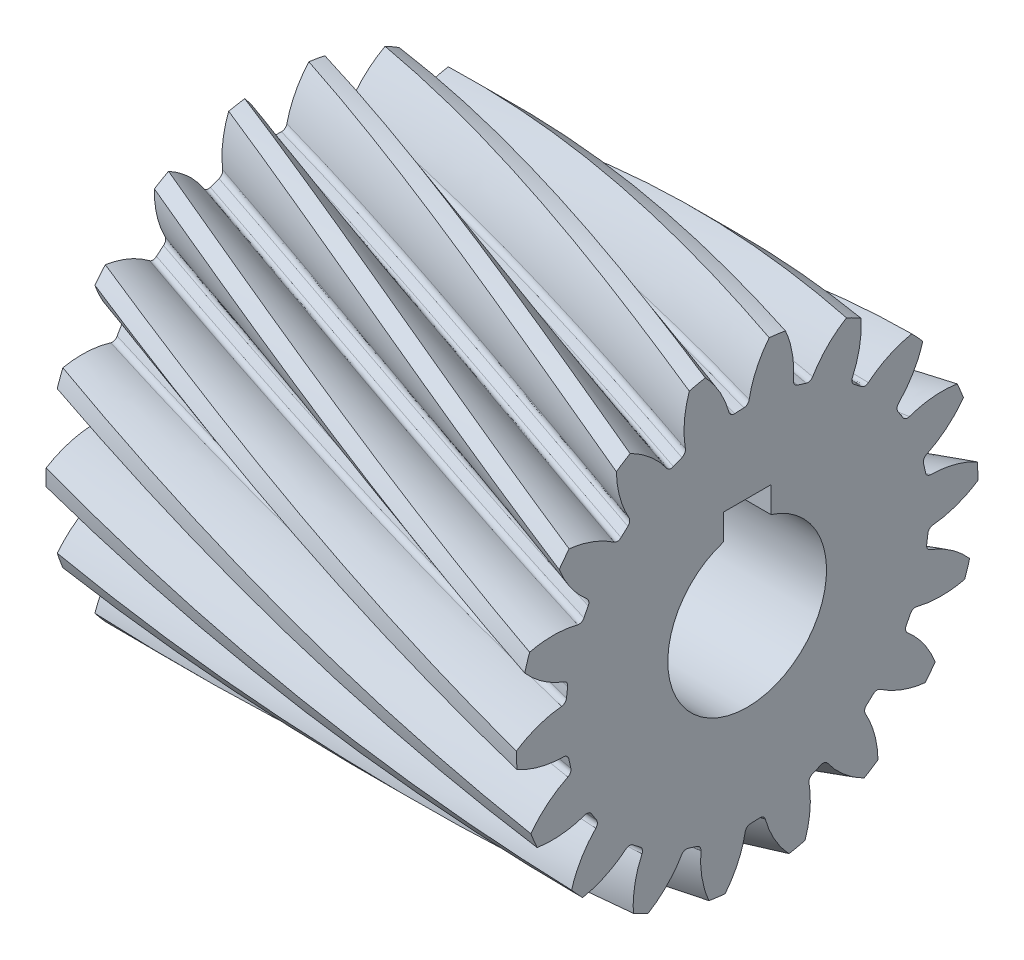
from build123d import *

# Parameters (mm, degrees)
BASPROSKE_W            = 59.275
BASPROSKE_H            = 29.088399869
TOOTHCUTRH_PITCH       = 502.150421815
TOOTHCUTRH_HEIGHT      = 59.275
TOOTHCUTRH_RADIUS      = 29.088399869
TOOTHCUTRH_START_ANGLE = -90
TEETHCUTSRH_COUNT      = 18
TEETHCUTSRH_ANGLE      = 340
BORSKE_R               = 10
BORE_DEPTH             = 74.0937525
KEYSKE_W               = 6
KEYSKE_H               = 12.8
KEYWAY_DEPTH           = 74.0937525


with BuildPart() as part:
    # BasProSke → Base-Revolve (revolve)
    with BuildSketch(Plane(origin=(0, 0, 0), x_dir=(1, 0, 0), z_dir=(0, 1, 0)), mode=Mode.PRIVATE) as base_revolve_sk:
        with Locations((29.6375, 14.544199935)):
            Rectangle(BASPROSKE_W, BASPROSKE_H)
    revolve(base_revolve_sk.sketch.rotate(Axis((-10, 0, 0), (1, 0, 0)), 180), axis=Axis((-10, 0, 0), (1, 0, 0)))

    # ToothCutRH: sweep along a helix
    with BuildLine() as toothcutrh_path:
        add(Helix(TOOTHCUTRH_PITCH, TOOTHCUTRH_HEIGHT, TOOTHCUTRH_RADIUS, center=(0, 0, 0), direction=(1, 0, 0), mode=Mode.PRIVATE).rotate(Axis((0, 0, 0), (1, 0, 0)), TOOTHCUTRH_START_ANGLE))
    # TooCutSkeRH → ToothCutRH (sweep, cut)
    with BuildSketch(Plane(origin=(0, 0, 0), x_dir=(0, 0, -1), z_dir=(1, 0, 0))):
        with BuildLine():
            ThreePointArc((0.581139397, 22.893525106), (0, 22.900899869), (-0.581139397, 22.893525106))
            ThreePointArc((-0.581139397, 22.893525106), (-1.020096283, 23.037393276), (-1.26932548, 23.426322583))
            ThreePointArc((-1.26932548, 23.426322583), (-2.572631773, 26.758289019), (-4.774670131, 29.578153323))
            ThreePointArc((-4.774670131, 29.578153323), (0, 29.961051865), (4.774670131, 29.578153323))
            ThreePointArc((4.774670131, 29.578153323), (2.572631773, 26.758289019), (1.26932548, 23.426322583))
            ThreePointArc((1.26932548, 23.426322583), (1.020096283, 23.037393276), (0.581139397, 22.893525106))
        make_face()
    toothcutrh = sweep(path=toothcutrh_path.line, is_frenet=True, mode=Mode.SUBTRACT)

    # TeethCutsRH: ToothCutRH ×18 about axis
    teethcutsrh_axis = Axis((-10, 0, 0), (1, 0, 0))
    for i in range(1, TEETHCUTSRH_COUNT):
        add(toothcutrh.rotate(teethcutsrh_axis, i * TEETHCUTSRH_ANGLE / (TEETHCUTSRH_COUNT - 1)), mode=Mode.SUBTRACT)

    # BorSke → Bore (cut, symmetric)
    with BuildSketch(Plane(origin=(0, 0, 0), x_dir=(0, 0, -1), z_dir=(1, 0, 0))):
        with Locations(Location((0, 0, 0), (0, 0, 180))):
            Circle(BORSKE_R)
    extrude(amount=BORE_DEPTH, both=True, mode=Mode.SUBTRACT)

    # KeySke → Keyway (cut, symmetric)
    with BuildSketch(Plane(origin=(0, 0, 0), x_dir=(0, 0, -1), z_dir=(1, 0, 0))):
        with Locations((0, 6.4)):
            Rectangle(KEYSKE_W, KEYSKE_H)
    extrude(amount=KEYWAY_DEPTH, both=True, mode=Mode.SUBTRACT)


solid = part.part
